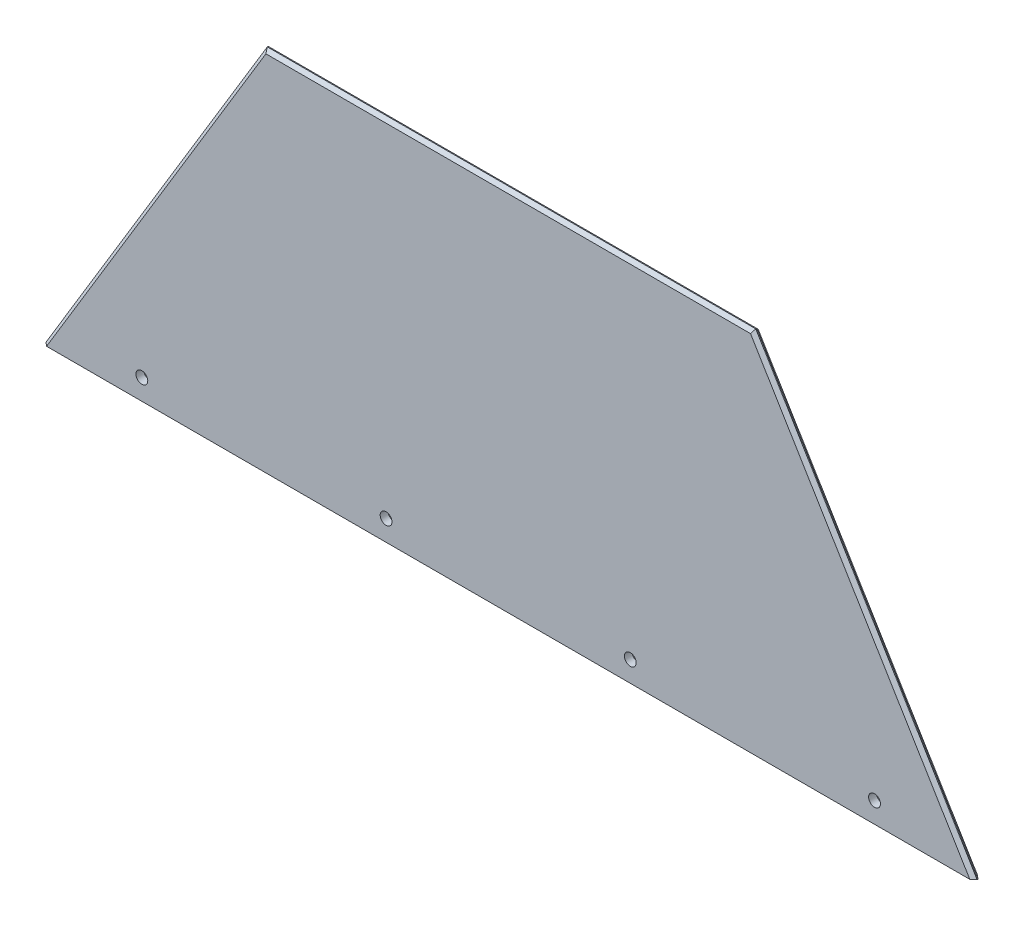
from build123d import *

# Parameters (mm, degrees)
EXTRUDE1_DEPTH               = 1.5875
CHAMFER1_SIZE                = 1.397
F_10_0_1935_DIAMETER_HOLE1_D = 4.9149
LPATTERN2_COUNT              = 3
LPATTERN2_PITCH              = 101.6
LPATTERN2_COUNT_DIR2         = 2
LPATTERN2_PITCH_DIR2         = 101.6


with BuildPart() as part:
    # Sketch1 → Extrude1 (new, symmetric)
    with BuildSketch(Plane.XY):
        Polygon((0, 0), (193.675, 0), (101.6, 152.4), (0, 152.4), (-101.6, 152.4), (-193.675, 0), align=None)
    extrude(amount=EXTRUDE1_DEPTH, both=True)

    # Chamfer1
    chamfer1_edges = [part.edges().sort_by_distance(p)[0] for p in [
        (147.6375, 76.2, -1.5875),
        (0, 152.4, -1.5875),
        (-147.6375, 76.2, -1.5875),
        (147.6375, 76.2, 1.5875),
        (0, 152.4, 1.5875),
        (-147.6375, 76.2, 1.5875),
    ]]
    chamfer(chamfer1_edges, length=CHAMFER1_SIZE)

    # #10 (0.1935) Diameter Hole1 (through all)
    with Locations(Plane(origin=(50.8, 8.5852, 1.5875), x_dir=(1, 0, 0), z_dir=(0, 0, 1))):
        with Locations((0, 0)):
            f_10_0_1935_diameter_hole1 = Hole(F_10_0_1935_DIAMETER_HOLE1_D / 2)

    # LPattern2: 10 _0.1935_ Diameter Hole1 3 × 2
    with Locations(*[Vector(-1, 0, 0) * (i * LPATTERN2_PITCH) + Vector(1, 0, 0) * (j * LPATTERN2_PITCH_DIR2) for i in range(LPATTERN2_COUNT) for j in range(LPATTERN2_COUNT_DIR2) if (i, j) != (0, 0)]):
        add(f_10_0_1935_diameter_hole1, mode=Mode.SUBTRACT)


solid = part.part
